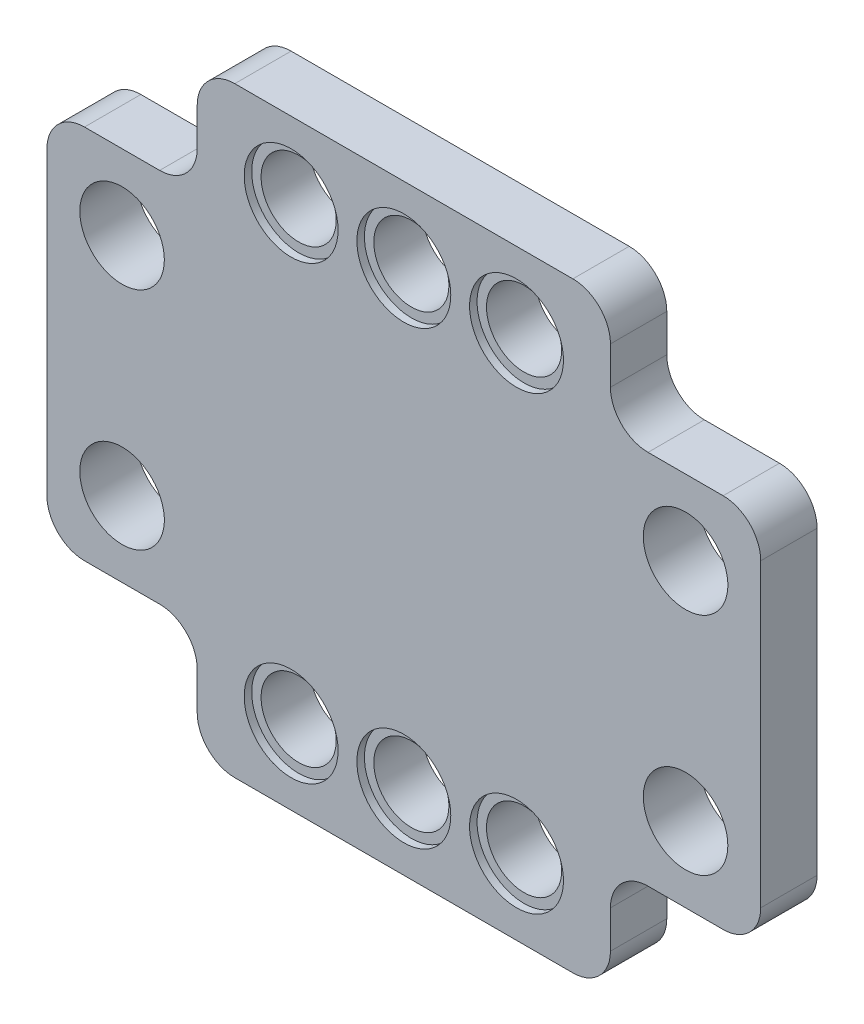
from build123d import *

# Parameters (mm, degrees)
ESQUISSE2_W                  = 38
ESQUISSE2_H                  = 32
BOSS_EXTRU_1_DEPTH           = 3
ENL_V_MAT_EXTRU_1_DEPTH      = 50.769468553
ENL_V_MAT_EXTRU_1_DEPTH_BACK = 50.769468553
ESQUISSE3_R                  = 2
ESQUISSE3_R_2                = 2.25
ESQUISSE4_R                  = 2.5
ENL_V_MAT_EXTRU_2_DEPTH      = 0.4
ENL_V_MAT_EXTRU_3_DEPTH      = 50.769468553
ENL_V_MAT_EXTRU_3_DEPTH_BACK = 50.769468553
ESQUISSE5_W                  = 8
ESQUISSE5_H                  = 6
CONG_1_R                     = 2


with BuildPart() as part:
    # Esquisse2 → Boss.-Extru.1 (new body)
    with BuildSketch(Plane.XY):
        with Locations((19, 16)):
            Rectangle(ESQUISSE2_W, ESQUISSE2_H)
    extrude(amount=BOSS_EXTRU_1_DEPTH)

    # Esquisse3 → Enlèv. mat.-Extru.1 (cut, two sides: drawn at the far end of the back side and taken through both)
    with BuildSketch(Plane.XY.offset(3).offset(-ENL_V_MAT_EXTRU_1_DEPTH_BACK)):
        with Locations((19, 28)):
            Circle(ESQUISSE3_R)
        with Locations((13, 28)):
            Circle(ESQUISSE3_R)
        with Locations((25, 28)):
            Circle(ESQUISSE3_R)
        with Locations((25, 4)):
            Circle(ESQUISSE3_R)
        with Locations((13, 4)):
            Circle(ESQUISSE3_R)
        with Locations((19, 4)):
            Circle(ESQUISSE3_R)
        with Locations((4, 22)):
            Circle(ESQUISSE3_R_2)
        with Locations((4, 10)):
            Circle(ESQUISSE3_R_2)
        with Locations((34, 10)):
            Circle(ESQUISSE3_R_2)
        with Locations((34, 22)):
            Circle(ESQUISSE3_R_2)
    extrude(amount=ENL_V_MAT_EXTRU_1_DEPTH + ENL_V_MAT_EXTRU_1_DEPTH_BACK, mode=Mode.SUBTRACT)

    # Esquisse4 → Enlèv. mat.-Extru.2 (cut)
    with BuildSketch(Plane.XY.offset(3)):
        with Locations((13, 4)):
            Circle(ESQUISSE4_R)
        with Locations((19, 4)):
            Circle(ESQUISSE4_R)
        with Locations((25, 4)):
            Circle(ESQUISSE4_R)
        with Locations((25, 28)):
            Circle(ESQUISSE4_R)
        with Locations((19, 28)):
            Circle(ESQUISSE4_R)
        with Locations((13, 28)):
            Circle(ESQUISSE4_R)
    extrude(amount=-ENL_V_MAT_EXTRU_2_DEPTH, mode=Mode.SUBTRACT)

    # Esquisse5 → Enlèv. mat.-Extru.3 (cut, two sides: drawn at the far end of the back side and taken through both)
    with BuildSketch(Plane.XY.offset(3).offset(-ENL_V_MAT_EXTRU_3_DEPTH_BACK)):
        with Locations((4, 29)):
            Rectangle(ESQUISSE5_W, ESQUISSE5_H)
        with Locations((34, 29)):
            Rectangle(ESQUISSE5_W, ESQUISSE5_H)
        with Locations((34, 3)):
            Rectangle(ESQUISSE5_W, ESQUISSE5_H)
        with Locations((4, 3)):
            Rectangle(ESQUISSE5_W, ESQUISSE5_H)
    extrude(amount=ENL_V_MAT_EXTRU_3_DEPTH + ENL_V_MAT_EXTRU_3_DEPTH_BACK, mode=Mode.SUBTRACT)

    # Congé1
    cong_1_edges = [part.edges().sort_by_distance(p)[0] for p in [
        (30, 32, 1.5),
        (30, 26, 1.5),
        (38, 26, 1.5),
        (38, 6, 1.5),
        (30, 6, 1.5),
        (30, 0, 1.5),
        (8, 0, 1.5),
        (8, 6, 1.5),
        (0, 6, 1.5),
        (0, 26, 1.5),
        (8, 32, 1.5),
        (8, 26, 1.5),
    ]]
    fillet(cong_1_edges, radius=CONG_1_R)


solid = part.part
